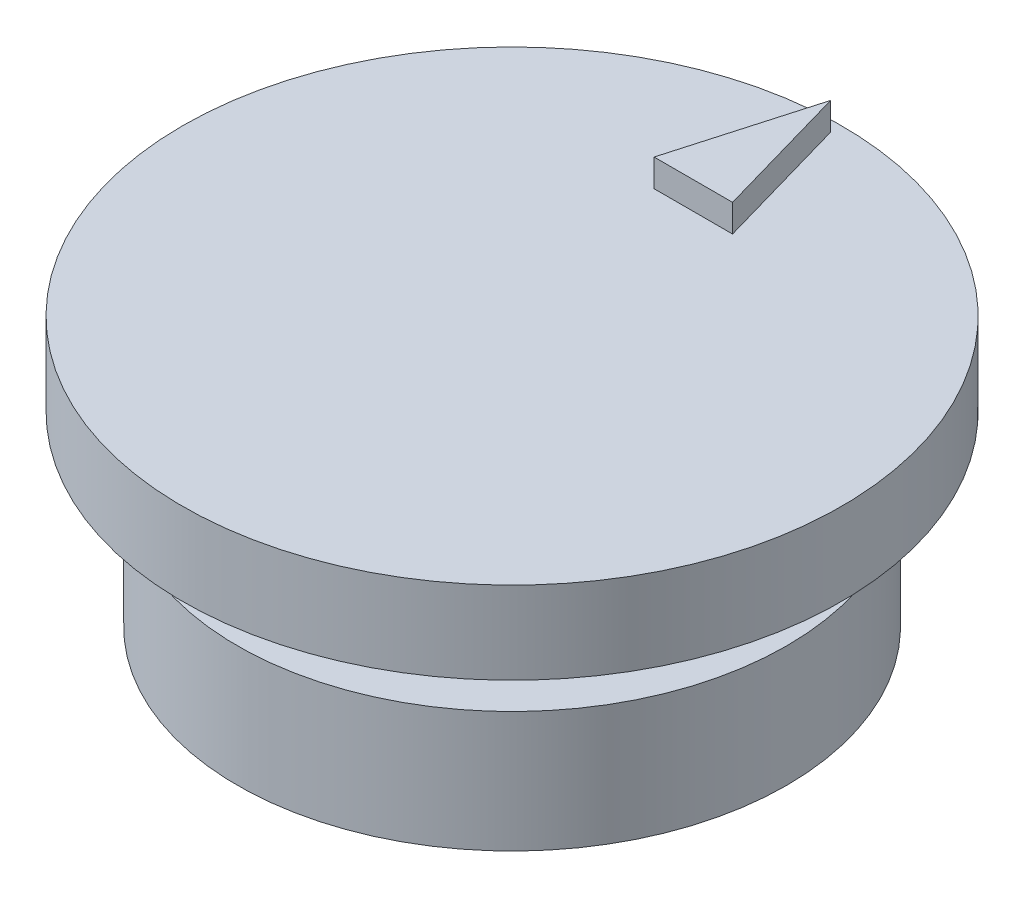
from build123d import *

# Parameters (mm, degrees)
ARROW_DEPTH = 1.27
SKETCH3_R   = 1.798915991
FLAG_DEPTH  = 6.35


with BuildPart() as part:
    # Sketch1 → dial base shape (revolve)
    with BuildSketch(Plane.XY):
        Polygon((0, -24.447058424), (0, -36.893058424), (12.7, -36.893058424), (12.7, -31.305058424), (3.175, -31.305058424), (3.175, -29.781058424), (12.7, -29.781058424), (12.7, -28.257058424), (15.24, -28.257058424), (15.24, -24.447058424), align=None)
    revolve(axis=Axis((0, -24.447058424, 0), (0, -1, 0)))

    # Sketch2 → arrow (add)
    with BuildSketch(Plane(origin=(0, -24.447058424, 0), x_dir=(1, 0, 0), z_dir=(0, 1, 0))):
        Polygon((0, 14.732), (-1.813922821, 8.382), (1.813922821, 8.382), align=None)
    extrude(amount=ARROW_DEPTH)

    # Sketch3 → flag (add)
    with BuildSketch(Plane.XZ.offset(36.893058424)):
        with Locations((0, -9.854910999)):
            Circle(SKETCH3_R)
    extrude(amount=FLAG_DEPTH)


solid = part.part
